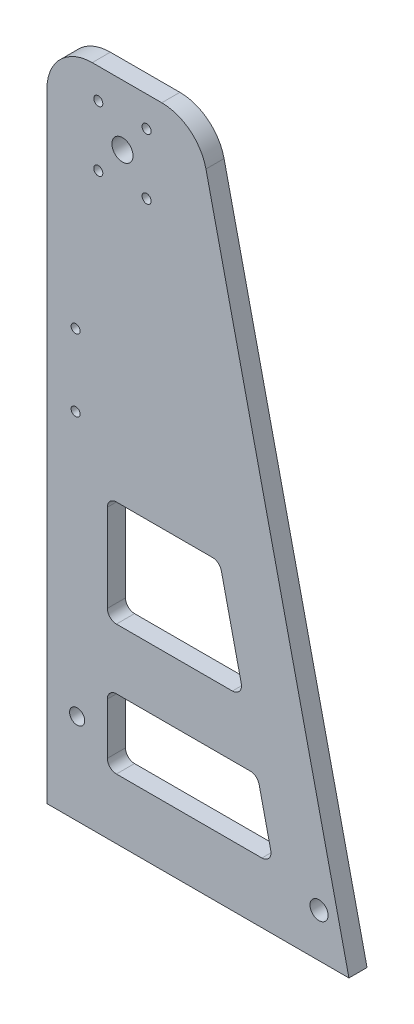
from build123d import *

# Parameters (mm, degrees)
ESBO_O1_R                = 1.5
ESBO_O1_R_2              = 3.5
ESBO_O1_R_3              = 2.5
RESSALTO_EXTRUS_O2_DEPTH = 6
FILETE1_R                = 15
ESBO_O2_R                = 3
CORTE_EXTRUS_O1_DEPTH    = 10
ESBO_O3_RX               = 1.5
ESBO_O3_RY               = 1.426584774
CORTE_EXTRUS_O2_DEPTH    = 242.735392527


with BuildPart() as part:
    # Esboço1 → Ressalto-extrusão2 (new body)
    with BuildSketch(Plane.XY):
        Polygon((0, 0), (0, 220), (50, 220), (100, 0), align=None)
        with Locations((17, 210)):
            Circle(ESBO_O1_R, mode=Mode.SUBTRACT)
        with Locations((33, 210)):
            Circle(ESBO_O1_R, mode=Mode.SUBTRACT)
        with Locations((33, 190)):
            Circle(ESBO_O1_R, mode=Mode.SUBTRACT)
        with Locations((17, 190)):
            Circle(ESBO_O1_R, mode=Mode.SUBTRACT)
        with Locations((25, 200)):
            Circle(ESBO_O1_R_2, mode=Mode.SUBTRACT)
        with Locations((10, 30)):
            Circle(ESBO_O1_R_3, mode=Mode.SUBTRACT)
        with BuildLine():
            Line((20, 95), (20, 66))
            ThreePointArc((20, 66), (20.878679656, 63.878679656), (23, 63))
            Line((23, 63), (61.413470366, 63))
            ThreePointArc((61.413470366, 63), (63.75810146, 64.128448496), (64.338868934, 66.664863311))
            Line((64.338868934, 66.664863311), (57.747959843, 95.664863311))
            ThreePointArc((57.747959843, 95.664863311), (56.69411278, 97.344631094), (54.822561275, 98))
            Line((54.822561275, 98), (23, 98))
            ThreePointArc((23, 98), (20.878679656, 97.121320344), (20, 95))
        make_face(mode=Mode.SUBTRACT)
        with BuildLine():
            Line((20, 40), (20, 23))
            ThreePointArc((20, 23), (20.878679656, 20.878679656), (23, 20))
            Line((23, 20), (71.186197639, 20))
            ThreePointArc((71.186197639, 20), (73.530828733, 21.128448496), (74.111596206, 23.664863311))
            Line((74.111596206, 23.664863311), (70.247959843, 40.664863311))
            ThreePointArc((70.247959843, 40.664863311), (69.19411278, 42.344631094), (67.322561275, 43))
            Line((67.322561275, 43), (23, 43))
            ThreePointArc((23, 43), (20.878679656, 42.121320344), (20, 40))
        make_face(mode=Mode.SUBTRACT)
    extrude(amount=RESSALTO_EXTRUS_O2_DEPTH)

    # Filete1
    filete1_edges = [part.edges().sort_by_distance(p)[0] for p in [
        (0, 220, 3),
        (50, 220, 3),
    ]]
    fillet(filete1_edges, radius=FILETE1_R)

    # Esboço2 → Corte-extrusão1 (cut)
    with BuildSketch(Plane(origin=(0, 0, 0), x_dir=(-1, 0, 0), z_dir=(0, 0, -1))):
        with Locations((-90.096252795, 14.5)):
            Circle(ESBO_O2_R)
    extrude(amount=-CORTE_EXTRUS_O1_DEPTH, mode=Mode.SUBTRACT)

    # Esboço3 → Corte-extrusão2 (cut, through all)
    with BuildSketch(Plane(origin=(0, 0, 0), x_dir=(-1, 0, 0), z_dir=(0, 0, -1))):
        with Locations((-9.5, 117.202456767)):
            Ellipse(ESBO_O3_RX, ESBO_O3_RY)
        with Locations((-9.5, 140.978869674)):
            Ellipse(ESBO_O3_RX, ESBO_O3_RY)
    extrude(amount=-CORTE_EXTRUS_O2_DEPTH, mode=Mode.SUBTRACT)


solid = part.part
